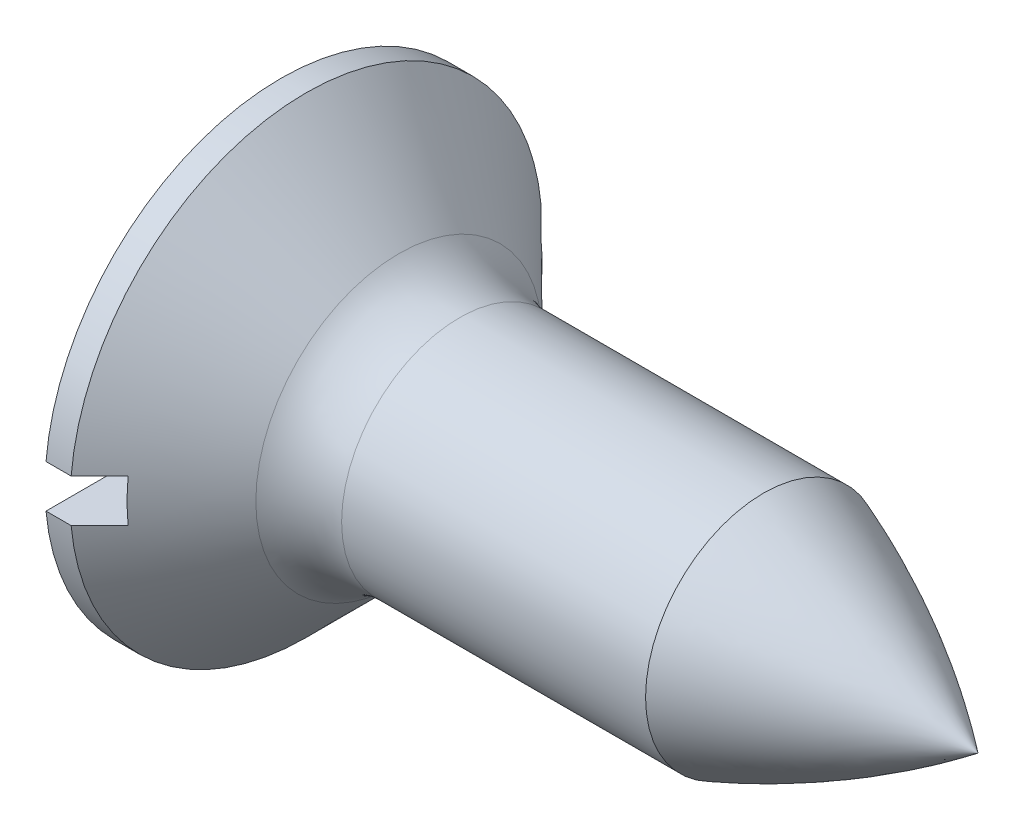
from build123d import *

# Parameters (mm, degrees)
SLOT_DEPTH      = 8.20624729
SLOT_DEPTH_BACK = 8.20624729
SKETCH2_W       = 0.5
SKETCH2_H       = 0.4


with BuildPart() as part:
    # Sketch1 → Base (revolve)
    with BuildSketch(Plane.XY):
        with BuildLine():
            Line((6.5, 0), (6.5, 1.1))
            Line((6.5, 1.1), (1.665685425, 1.1))
            ThreePointArc((1.665685425, 1.1), (1.359538679, 1.160896374), (1.1, 1.334314575))
            Line((1.1, 1.334314575), (0.234314575, 2.2))
            Line((0.234314575, 2.2), (0, 2.2))
            Line((0, 2.2), (0, 0))
            Line((0, 0), (6.5, 0))
        make_face()
    revolve(axis=Axis((-9.694470106, 0, 0), (1, 0, 0)))

    # Sketch2 → Slot (cut, two sides: drawn at the far end of the back side and taken through both)
    with BuildSketch(Plane.XY.offset(-SLOT_DEPTH_BACK)):
        with Locations((0.25, 0)):
            Rectangle(SKETCH2_W, SKETCH2_H)
    extrude(amount=SLOT_DEPTH + SLOT_DEPTH_BACK, mode=Mode.SUBTRACT)

    # Sketch4 → Cut-Revolve6 (revolve, cut)
    with BuildSketch(Plane.XY):
        with BuildLine():
            Line((6.5, 0), (7, 0))
            Line((7, 0), (7, -1.1))
            Line((7, -1.1), (6.5, -1.1))
            Line((6.5, -1.1), (4.5, -1.1))
            ThreePointArc((4.5, -1.1), (5.53943286, -0.621696108), (6.5, 0))
        make_face()
    revolve(axis=Axis((33.240663239, 0, 0), (-1, 0, 0)), mode=Mode.SUBTRACT)


solid = part.part
